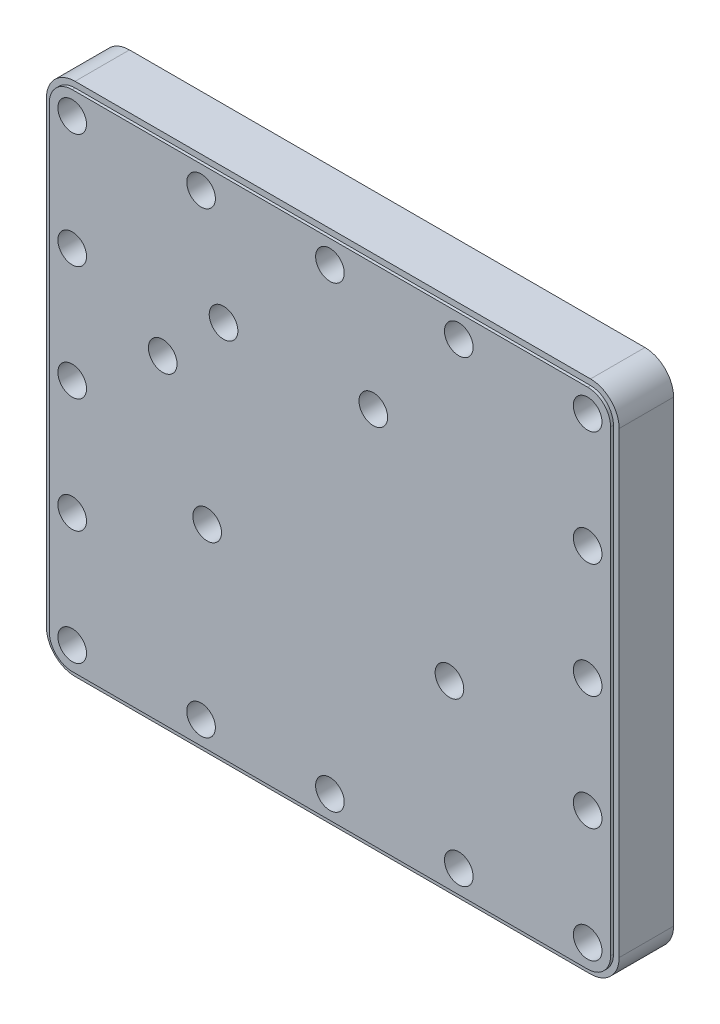
from build123d import *

# Parameters (mm, degrees)
SKETCH_1_R          = 5
EXTRUDE_1_DEPTH     = 10
SKETCH_2_W          = 160
SKETCH_2_H          = 140
CUT_EXTRUDE_1_DEPTH = 1
CUT_EXTRUDE_2_DEPTH = 1


with BuildPart() as part:
    # 草图1 → 凸台-拉伸1 (new, symmetric)
    with BuildSketch(Plane.XY):
        with BuildLine():
            Line((-90, -90), (90, -90))
            ThreePointArc((90, -90), (97.071067812, -87.071067812), (100, -80))
            Line((100, -80), (100, 80))
            ThreePointArc((100, 80), (97.071067812, 87.071067812), (90, 90))
            Line((90, 90), (-90, 90))
            ThreePointArc((-90, 90), (-97.071067812, 87.071067812), (-100, 80))
            Line((-100, 80), (-100, -80))
            ThreePointArc((-100, -80), (-97.071067812, -87.071067812), (-90, -90))
        make_face()
        with Locations((-90, 80)):
            Circle(SKETCH_1_R, mode=Mode.SUBTRACT)
        with Locations((90, 80)):
            Circle(SKETCH_1_R, mode=Mode.SUBTRACT)
        with Locations((90, -80)):
            Circle(SKETCH_1_R, mode=Mode.SUBTRACT)
        with Locations((-90, -80)):
            Circle(SKETCH_1_R, mode=Mode.SUBTRACT)
        with Locations((-37.156030243, 43.920850966)):
            Circle(SKETCH_1_R, mode=Mode.SUBTRACT)
        with Locations((15.145121023, 43.920850966)):
            Circle(SKETCH_1_R, mode=Mode.SUBTRACT)
        with Locations((-58.386061631, 23.270870328)):
            Circle(SKETCH_1_R, mode=Mode.SUBTRACT)
        with Locations((-42.862802557, -19.941076014)):
            Circle(SKETCH_1_R, mode=Mode.SUBTRACT)
        with Locations((41.733222374, -24.941076014)):
            Circle(SKETCH_1_R, mode=Mode.SUBTRACT)
        with Locations((90, 0)):
            Circle(SKETCH_1_R, mode=Mode.SUBTRACT)
        with Locations((90, 40)):
            Circle(SKETCH_1_R, mode=Mode.SUBTRACT)
        with Locations((90, -40)):
            Circle(SKETCH_1_R, mode=Mode.SUBTRACT)
        with Locations((-90, -40)):
            Circle(SKETCH_1_R, mode=Mode.SUBTRACT)
        with Locations((-90, 0)):
            Circle(SKETCH_1_R, mode=Mode.SUBTRACT)
        with Locations((-90, 40)):
            Circle(SKETCH_1_R, mode=Mode.SUBTRACT)
        with Locations((0, 80)):
            Circle(SKETCH_1_R, mode=Mode.SUBTRACT)
        with Locations((-45, 80)):
            Circle(SKETCH_1_R, mode=Mode.SUBTRACT)
        with Locations((45, 80)):
            Circle(SKETCH_1_R, mode=Mode.SUBTRACT)
        with Locations((45, -80)):
            Circle(SKETCH_1_R, mode=Mode.SUBTRACT)
        with Locations((0, -80)):
            Circle(SKETCH_1_R, mode=Mode.SUBTRACT)
        with Locations((-45, -80)):
            Circle(SKETCH_1_R, mode=Mode.SUBTRACT)
    extrude(amount=EXTRUDE_1_DEPTH, both=True)

    # 草图2 → 切除-拉伸1 (cut)
    with BuildSketch(Plane(origin=(0, 0, -10), x_dir=(-1, 0, 0), z_dir=(0, 0, -1))):
        Rectangle(SKETCH_2_W, SKETCH_2_H)
    extrude(amount=-CUT_EXTRUDE_1_DEPTH, mode=Mode.SUBTRACT)

    # 草图3 → 切除-拉伸2 (cut)
    with BuildSketch(Plane.XY.offset(10)):
        with BuildLine():
            Line((90, 90), (-90, 90))
            ThreePointArc((-90, 90), (-97.071067812, 87.071067812), (-100, 80))
            Line((-100, 80), (-100, -80))
            ThreePointArc((-100, -80), (-97.071067812, -87.071067812), (-90, -90))
            Line((-90, -90), (90, -90))
            ThreePointArc((90, -90), (97.071067812, -87.071067812), (100, -80))
            Line((100, -80), (100, 80))
            ThreePointArc((100, 80), (97.071067812, 87.071067812), (90, 90))
        make_face()
        with BuildLine():
            Line((90, 88), (-90, 88))
            ThreePointArc((-90, 88), (-95.656854249, 85.656854249), (-98, 80))
            Line((-98, 80), (-98, -80))
            ThreePointArc((-98, -80), (-95.656854249, -85.656854249), (-90, -88))
            Line((-90, -88), (90, -88))
            ThreePointArc((90, -88), (95.656854249, -85.656854249), (98, -80))
            Line((98, -80), (98, 80))
            ThreePointArc((98, 80), (95.656854249, 85.656854249), (90, 88))
        make_face(mode=Mode.SUBTRACT)
    extrude(amount=-CUT_EXTRUDE_2_DEPTH, mode=Mode.SUBTRACT)


solid = part.part
